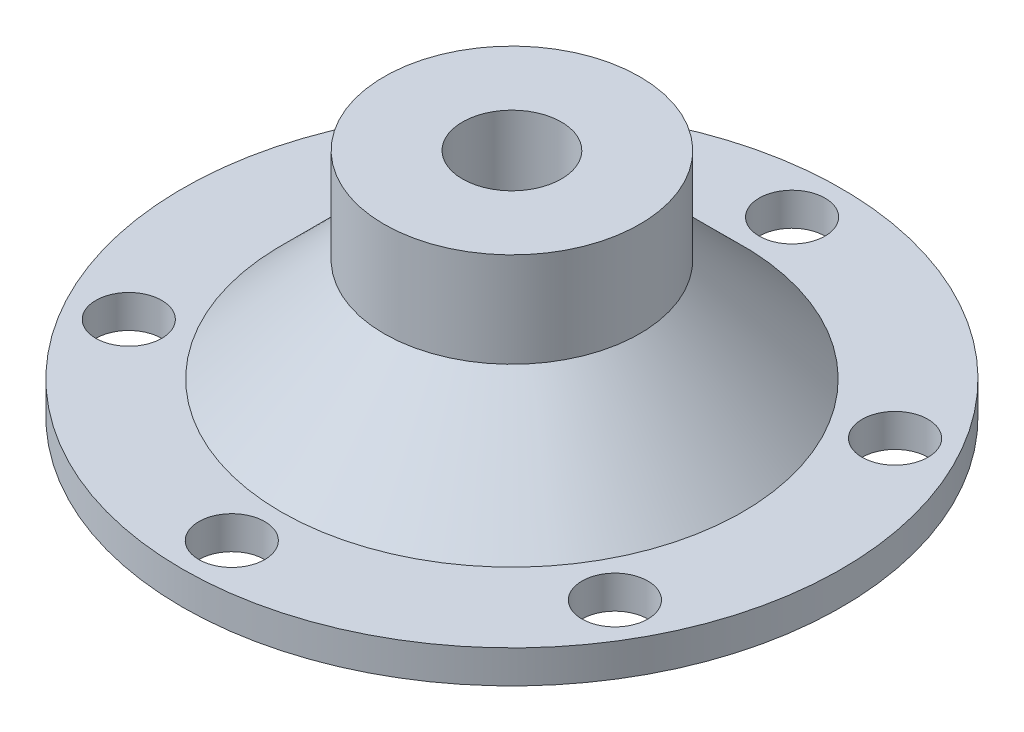
from build123d import *

# Parameters (mm, degrees)
SKETCH1_R           = 127
BOSS_EXTRUDE1_DEPTH = 12.7
SKETCH2_R           = 12.7
CUT_EXTRUDE1_DEPTH  = 12.7
SKETCH3_R           = 88.9
BOSS_EXTRUDE2_DEPTH = 39.6875
CHAMFER1_SIZE       = 39.6875
SKETCH4_R           = 19.05
CUT_EXTRUDE5_DEPTH  = 88.4555
BOSS_EXTRUDE3_START = 36.5125
SKETCH5_R           = 49.276
SKETCH5_R_2         = 19.05
BOSS_EXTRUDE3_DEPTH = 36.5125


with BuildPart() as part:
    # Sketch1 → Boss-Extrude1 (new body)
    with BuildSketch(Plane(origin=(0, 0, 0), x_dir=(1, 0, 0), z_dir=(0, 1, 0))):
        with Locations(Location((0, 0, 0), (0, 0, 270))):
            Circle(SKETCH1_R)
    extrude(amount=BOSS_EXTRUDE1_DEPTH)

    # Sketch2 → Cut-Extrude1 (cut)
    with BuildSketch(Plane(origin=(0, 12.7, 0), x_dir=(1, 0, 0), z_dir=(0, 1, 0))):
        with Locations(Location((0, 107.95, 0), (0, 0, 270))):
            Circle(SKETCH2_R)
        with Locations(Location((0, -107.95, 0), (0, 0, 270))):
            Circle(SKETCH2_R)
        with Locations(Location((-93.6625, -53.975, 0), (0, 0, 270))):
            Circle(SKETCH2_R)
        with Locations(Location((-93.6625, 53.975, 0), (0, 0, 270))):
            Circle(SKETCH2_R)
        with Locations(Location((93.6625, 53.975, 0), (0, 0, 270))):
            Circle(SKETCH2_R)
        with Locations(Location((93.6625, -53.975, 0), (0, 0, 270))):
            Circle(SKETCH2_R)
    extrude(amount=-CUT_EXTRUDE1_DEPTH, mode=Mode.SUBTRACT)

    # Sketch3 → Boss-Extrude2 (add)
    with BuildSketch(Plane(origin=(0, 12.7, 0), x_dir=(1, 0, 0), z_dir=(0, 1, 0))):
        with Locations(Location((0, 0, 0), (0, 0, 90))):
            Circle(SKETCH3_R)
    extrude(amount=BOSS_EXTRUDE2_DEPTH)

    # Chamfer1
    chamfer1_edges = [part.edges().sort_by_distance(p)[0] for p in [
        (0, 52.3875, 88.9),
    ]]
    chamfer(chamfer1_edges, length=CHAMFER1_SIZE - 0.0001)  # a hair under: the kernel refuses the full size

    # Sketch4 → Cut-Extrude5 (cut)
    with BuildSketch(Plane(origin=(0, 52.3875, 0), x_dir=(1, 0, 0), z_dir=(0, 1, 0))):
        with Locations(Location((0, 0, 0), (0, 0, 270))):
            Circle(SKETCH4_R)
    extrude(amount=-CUT_EXTRUDE5_DEPTH, mode=Mode.SUBTRACT)

    # Sketch5 → Boss-Extrude3 (add)
    with BuildSketch(Plane(origin=(0, 52.3875, 0), x_dir=(1, 0, 0), z_dir=(0, 1, 0)).offset(BOSS_EXTRUDE3_START)):
        with Locations(Location((0, 0, 0), (0, 0, 270))):
            Circle(SKETCH5_R)
        with Locations(Location((0, 0, 0), (0, 0, 270))):
            Circle(SKETCH5_R_2, mode=Mode.SUBTRACT)
    extrude(amount=-BOSS_EXTRUDE3_DEPTH)


solid = part.part
